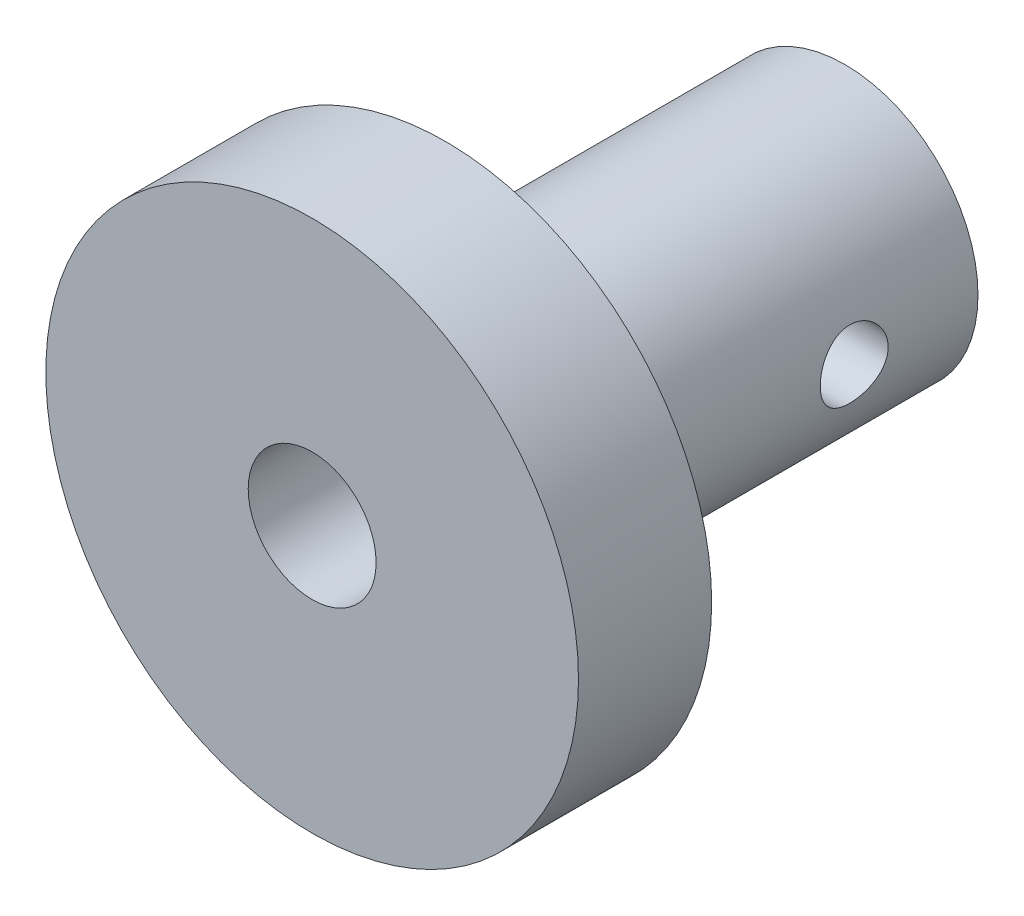
from build123d import *
from build123d.topology import SkipClean

# Parameters (mm, degrees)
SKETCH3_R               = 50.8
SKETCH3_R_2             = 12.194915436
BOSS_EXTRUDE1_DEPTH     = 25.4
BOSS_EXTRUDE2_START     = 76.2
SKETCH4_R               = 25.4
SKETCH4_R_2             = 12.194915436
BOSS_EXTRUDE2_DEPTH     = 76.2
CUT_EXTRUDE1_DEPTH      = 105.726882891
CUT_EXTRUDE1_DEPTH_BACK = 105.726882891
SKETCH5_R               = 6.477


with BuildPart() as part:
    # Sketch3 → Boss-Extrude1 (new body)
    with BuildSketch(Plane.XY):
        Circle(SKETCH3_R)
        Circle(SKETCH3_R_2, mode=Mode.SUBTRACT)
    extrude(amount=BOSS_EXTRUDE1_DEPTH)

    # Sketch4 → Boss-Extrude2 (add)
    with SkipClean():  # the faces are left unmerged after this step: merging them gives an invalid solid
        with BuildSketch(Plane(origin=(0, 0, 0), x_dir=(-1, 0, 0), z_dir=(0, 0, -1)).offset(BOSS_EXTRUDE2_START)):
            Circle(SKETCH4_R)
            Circle(SKETCH4_R_2, mode=Mode.SUBTRACT)
        extrude(amount=-BOSS_EXTRUDE2_DEPTH)

    # Sketch5 → Cut-Extrude1 (cut, two sides: drawn at the far end of the back side and taken through both)
    with SkipClean():  # the faces are left unmerged after this step: merging them gives an invalid solid
        with BuildSketch(Plane(origin=(0, 0, 0), x_dir=(0, 0, -1), z_dir=(1, 0, 0)).offset(-CUT_EXTRUDE1_DEPTH_BACK)):
            with Locations((52.590560768, 0)):
                Circle(SKETCH5_R)
        extrude(amount=CUT_EXTRUDE1_DEPTH + CUT_EXTRUDE1_DEPTH_BACK, mode=Mode.SUBTRACT)


solid = part.part
